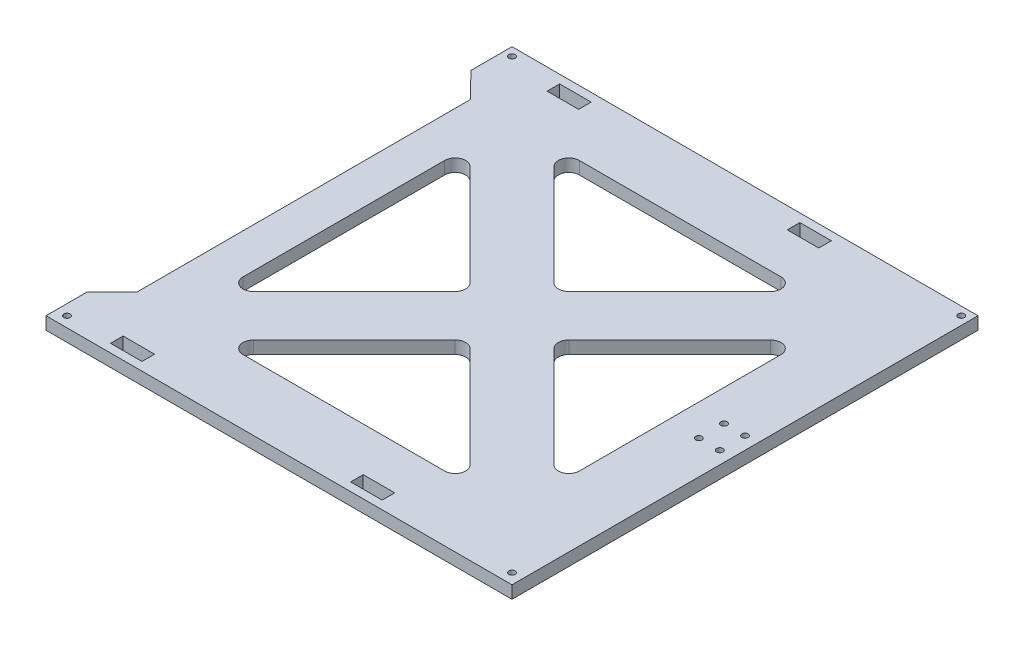
from build123d import *

# Parameters (mm, degrees)
SKETCH_1_R      = 1.5
SKETCH_1_W      = 14.999960721
SKETCH_1_H      = 6.000098196
SKETCH_1_H_2    = 6.000098195
EXTRUDE_1_DEPTH = 6


with BuildPart() as part:
    # Эскиз1 → Бобышка-Вытянуть1 (new body)
    with BuildSketch(Plane(origin=(0, 0, 0), x_dir=(1, 0, 0), z_dir=(0, 1, 0))):
        Polygon((-102.768102854, -109.532435011), (-102.768102854, -89.9181765), (-90.880452852, -77.91423458), (-90.880452852, 80.849364559), (-102.768102854, 92.853306479), (-102.768102854, 112.467564989), (119.231897146, 112.467564989), (119.231897146, -109.532435011), align=None)
        with Locations((-98.768102854, 108.467564989)):
            Circle(SKETCH_1_R, mode=Mode.SUBTRACT)
        with Locations((115.231897146, 108.467564989)):
            Circle(SKETCH_1_R, mode=Mode.SUBTRACT)
        with Locations((-97.768102854, -104.532435011)):
            Circle(SKETCH_1_R, mode=Mode.SUBTRACT)
        with Locations((114.231897146, -104.532435011)):
            Circle(SKETCH_1_R, mode=Mode.SUBTRACT)
        with Locations((103.231897146, 7.467564989)):
            Circle(SKETCH_1_R, mode=Mode.SUBTRACT)
        with Locations((113.231897146, 7.467564989)):
            Circle(SKETCH_1_R, mode=Mode.SUBTRACT)
        with Locations((113.231897146, -4.532435011)):
            Circle(SKETCH_1_R, mode=Mode.SUBTRACT)
        with Locations((103.231897146, -4.532435011)):
            Circle(SKETCH_1_R, mode=Mode.SUBTRACT)
        with Locations((-68.539568551, 105.467614087)):
            Rectangle(SKETCH_1_W, SKETCH_1_H, mode=Mode.SUBTRACT)
        with Locations((45.860431447, 105.467614087)):
            Rectangle(SKETCH_1_W, SKETCH_1_H, mode=Mode.SUBTRACT)
        with Locations((45.860431447, -102.532484109)):
            Rectangle(SKETCH_1_W, SKETCH_1_H_2, mode=Mode.SUBTRACT)
        with Locations((-68.539568551, -102.532484109)):
            Rectangle(SKETCH_1_W, SKETCH_1_H_2, mode=Mode.SUBTRACT)
        with BuildLine():
            Line((-15.30363676, 5.003098895), (-63.336645349, 53.036107484))
            ThreePointArc((-63.336645349, 53.036107484), (-68.785596417, 54.119971241), (-71.872179255, 49.500573578))
            Line((-71.872179255, 49.500573578), (-71.872179255, -46.5654436))
            ThreePointArc((-71.872179255, -46.5654436), (-68.785596417, -51.184841262), (-63.336645349, -50.100977505))
            Line((-63.336645349, -50.100977505), (-15.30363676, -2.067968916))
            ThreePointArc((-15.30363676, -2.067968916), (-13.839170666, 1.467564989), (-15.30363676, 5.003098895))
        make_face(mode=Mode.SUBTRACT)
        with BuildLine():
            Line((31.767431052, 5.003098895), (79.800439641, 53.036107484))
            ThreePointArc((79.800439641, 53.036107484), (85.249390708, 54.119971241), (88.335973547, 49.500573578))
            Line((88.335973547, 49.500573578), (88.335973547, -46.5654436))
            ThreePointArc((88.335973547, -46.5654436), (85.249390708, -51.184841262), (79.800439641, -50.100977505))
            Line((79.800439641, -50.100977505), (31.767431052, -2.067968916))
            ThreePointArc((31.767431052, -2.067968916), (30.302964958, 1.467564989), (31.767431052, 5.003098895))
        make_face(mode=Mode.SUBTRACT)
        with BuildLine():
            Line((4.69636324, 25.003098895), (-43.336645349, 73.036107484))
            ThreePointArc((-43.336645349, 73.036107484), (-44.420509106, 78.485058552), (-39.801111443, 81.57164139))
            Line((-39.801111443, 81.57164139), (56.264905735, 81.57164139))
            ThreePointArc((56.264905735, 81.57164139), (60.884303397, 78.485058552), (59.800439641, 73.036107484))
            Line((59.800439641, 73.036107484), (11.767431052, 25.003098895))
            ThreePointArc((11.767431052, 25.003098895), (8.231897146, 23.538632801), (4.69636324, 25.003098895))
        make_face(mode=Mode.SUBTRACT)
        with BuildLine():
            Line((59.800439641, -70.100977505), (11.767431052, -22.067968916))
            ThreePointArc((11.767431052, -22.067968916), (8.231897146, -20.603502822), (4.69636324, -22.067968916))
            Line((4.69636324, -22.067968916), (-43.336645349, -70.100977505))
            ThreePointArc((-43.336645349, -70.100977505), (-44.420509106, -75.549928573), (-39.801111443, -78.636511411))
            Line((-39.801111443, -78.636511411), (56.264905735, -78.636511411))
            ThreePointArc((56.264905735, -78.636511411), (60.884303397, -75.549928573), (59.800439641, -70.100977505))
        make_face(mode=Mode.SUBTRACT)
    extrude(amount=EXTRUDE_1_DEPTH)


solid = part.part
